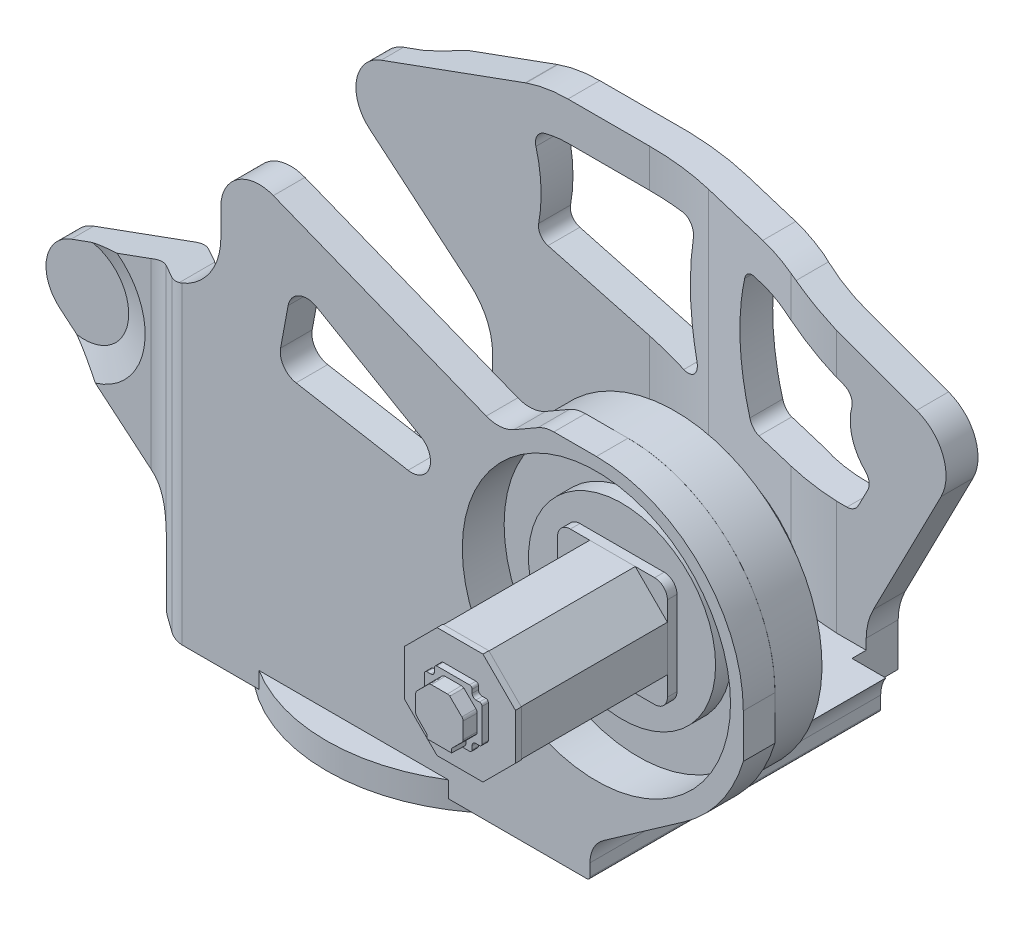
from build123d import *

# Parameters (mm, degrees)
SKETCH5_R           = 279.99944
BASE_EXTRUDE_DEPTH  = 40.64
BOSS_EXTRUDE1_DEPTH = 592.328
CUT_EXTRUDE1_DEPTH  = 645.16
CUT_EXTRUDE2_DEPTH  = 746.76
CUT_EXTRUDE3_DEPTH  = 137.16
SKETCH12_R          = 230.124
BOSS_EXTRUDE2_DEPTH = 73.66
SKETCH13_R          = 165.1
BOSS_EXTRUDE3_DEPTH = 46.99
SKETCH14_R          = 110.000000487
CUT_EXTRUDE4_DEPTH  = 14.732
CUT_EXTRUDE4_DRAFT  = -70
SKETCH15_R          = 110.000000487
CUT_EXTRUDE5_DEPTH  = 14.732
CUT_EXTRUDE5_DRAFT  = -70
SKETCH16_R          = 210.000005689
CUT_EXTRUDE6_DEPTH  = 65.532
SKETCH17_R          = 146.499150033
BOSS_EXTRUDE4_DEPTH = 25.4
CUT_EXTRUDE7_DEPTH  = 58.42
BOSS_EXTRUDE5_DEPTH = 14.9225
BOSS_EXTRUDE6_DEPTH = 229.5525
BOSS_EXTRUDE7_DEPTH = 9.2075
EXTRUDE1_DEPTH      = 10
EXTRUDE2_DEPTH      = 21.7475
EXTRUDE2_DRAFT      = 1


with BuildPart() as part:
    # Sketch5 → Base-Extrude (new body)
    with BuildSketch(Plane(origin=(0, 0, 0), x_dir=(1, 0, 0), z_dir=(0, 1, 0))):
        Circle(SKETCH5_R)
    extrude(amount=BASE_EXTRUDE_DEPTH)

    # Sketch7 → Boss-Extrude1 (add)
    with BuildSketch(Plane.XY.offset(237.470768924)):
        with BuildLine():
            Line((-320, 15), (365, 15))
            ThreePointArc((365, 15), (368.535533906, 16.464466094), (370, 20))
            Line((370, 20), (369.999997924, 38.97338))
            ThreePointArc((369.999997924, 38.97338), (375.648824796, 62.059602178), (391.31894, 79.92942))
            Line((391.31894, 79.92942), (517.66908, 168.41103))
            ThreePointArc((517.66908, 168.41103), (574.661777559, 224.619114997), (609.999998169, 296.443390546))
            Line((609.999998169, 296.443390546), (610, 364.99994))
            ThreePointArc((610, 364.99994), (542.634561472, 527.634501472), (380, 594.99994))
            Line((380, 594.99994), (313.35019, 594.99999871))
            ThreePointArc((313.35019, 594.99999871), (300.451848092, 593.307693227), (288.426629357, 588.345311118))
            Line((288.426629357, 588.345311118), (250.91462175, 566.775906957))
            ThreePointArc((250.91462175, 566.775906957), (229.60166481, 560.251756882), (207.5712, 563.6378))
            Line((207.5712, 563.6378), (-125.849603884, 695.761602153))
            ThreePointArc((-125.849603884, 695.761602153), (-181.697001766, 689.643841861), (-208.000001718, 640))
            Line((-208.000001718, 640), (-208.000001718, 597.50735))
            ThreePointArc((-208.000001718, 597.50735), (-226.084799306, 540.149706929), (-273.797989413, 503.538088386))
            Line((-273.797989413, 503.538088386), (-499.52121, 421.38155))
            ThreePointArc((-499.52121, 421.38155), (-538.088468005, 375.418886181), (-517.56726, 319.03733))
            Line((-517.56726, 319.03733), (-360.7212412, 187.42789857))
            ThreePointArc((-360.7212412, 187.42789857), (-334.36922012, 153.085279149), (-324.999998133, 110.82345))
            Line((-324.999998133, 110.82345), (-325, 20))
            ThreePointArc((-325, 20), (-323.535533906, 16.464466094), (-320, 15))
        make_face()
    extrude(amount=-BOSS_EXTRUDE1_DEPTH)

    # Sketch8 → Cut-Extrude1 (cut)
    with BuildSketch(Plane(origin=(0, 711.2, 0), x_dir=(-1, 0, 0), z_dir=(0, 1, 0))):
        with BuildLine():
            Line((534, -305), (79.16003, -304.999997297))
            ThreePointArc((79.16003, -304.999997297), (26.284839531, -301.882770521), (-25.857800631, -292.574282628))
            Line((-25.857800631, -292.574282628), (-195.634158682, -251.827967502))
            ThreePointArc((-195.634158682, -251.827967502), (-236.923956566, -243.954175272), (-278.7714, -240))
            Line((-278.7714, -240), (-640.135262635, -240))
            Line((-640.135262635, -240), (-640.135262635, 188.000000434))
            Line((-640.135262635, 188.000000434), (-220.258534809, 188.000000434))
            Line((-220.258534809, 188.000000434), (223.415876424, 188.000000434))
            Line((223.415876424, 188.000000434), (255.593035136, 188.000000434))
            ThreePointArc((255.593035136, 188.000000434), (267.271379261, 185.557900055), (276.9926, 178.64086))
            Line((276.9926, 178.64086), (310.335159488, 154.745348815))
            ThreePointArc((310.335159488, 154.745348815), (325.303913294, 147.313418989), (341.855205208, 145))
            Line((341.855205208, 145), (534, 145))
            Line((534, 145), (553.895380573, 145))
            Line((553.895380573, 145), (553.895380573, -305))
            Line((553.895380573, -305), (534, -305))
        make_face()
    extrude(amount=-CUT_EXTRUDE1_DEPTH, mode=Mode.SUBTRACT)

    # Sketch10 → Cut-Extrude2 (cut)
    with BuildSketch(Plane(origin=(86.326185056, 711.2, -208.856690882), x_dir=(-1, 0, 0), z_dir=(0, 1, 0))):
        with BuildLine():
            Line((286.47264948, 446.327459805), (347.395663879, 446.327459805))
            ThreePointArc((347.395663879, 446.327459805), (364.176871053, 444.761225907), (379.385455111, 437.497550957))
            Line((379.385455111, 437.497550957), (413.266914043, 413.215839468))
            ThreePointArc((413.266914043, 413.215839468), (428.754656216, 405.720497442), (445.859525056, 403.856691751))
            Line((445.859525056, 403.856691751), (643.355007055, 403.856691751))
            Line((643.355007055, 403.856691751), (643.355007055, 469.302072156))
            Line((643.355007055, 469.302072156), (286.47264948, 481.952752742))
            Line((286.47264948, 481.952752742), (286.47264948, 446.327459805))
        make_face()
        with BuildLine():
            Line((-18.673800559, -116.143310059), (48.799735046, -132.33695916))
            ThreePointArc((48.799735046, -132.33695916), (106.736002471, -142.679725184), (165.486215056, -146.143309076))
            Line((165.486215056, -146.143309076), (212.176007222, -146.143309076))
            Line((212.176007222, -146.143309076), (212.176007222, -224.529226835))
            Line((212.176007222, -224.529226835), (-585.623772318, -224.529226835))
            Line((-585.623772318, -224.529226835), (-585.623772318, -81.181309118))
            Line((-585.623772318, -81.181309118), (-192.445214944, -81.181309118))
            ThreePointArc((-192.445214944, -81.181309118), (-150.355133683, -84.504343601), (-109.307973119, -94.391107899))
            Line((-109.307973119, -94.391107899), (-18.673800559, -116.143310059))
        make_face()
    extrude(amount=-CUT_EXTRUDE2_DEPTH, mode=Mode.SUBTRACT)

    # Sketch11 → Cut-Extrude3 (cut)
    with BuildSketch(Plane(origin=(0, 0, -354.857231076), x_dir=(-1, 0, 0), z_dir=(0, 0, -1))):
        with BuildLine():
            Line((465.640101755, 433.71327166), (310.335159488, 490.23964524))
            Line((310.335159488, 490.23964524), (278.997937915, 501.645460701))
            ThreePointArc((278.997937915, 501.645460701), (243.633971151, 511.633100774), (207.041252078, 515))
            Line((207.041252078, 515), (-137.279297922, 515))
            ThreePointArc((-137.279297922, 515), (-172.008934474, 511.96154954), (-205.683327922, 502.93852))
            Line((-205.683327922, 502.93852), (-403.941407922, 430.77848))
            ThreePointArc((-403.941407922, 430.77848), (-445.177514908, 390.532163879), (-442.250107922, 332.98555))
            Line((-442.250107922, 332.98555), (-336.071287922, 126.52742))
            ThreePointArc((-336.071287922, 126.52742), (-327.98766041, 105.065992744), (-324.999997922, 82.3281))
            Line((-324.999997922, 82.3281), (-324.999997922, 0))
            Line((-324.999997922, 0), (-658.849729434, 0))
            Line((-658.849729434, 0), (-658.849729434, 772.256984031))
            Line((-658.849729434, 772.256984031), (465.640101755, 772.256984031))
            Line((465.640101755, 772.256984031), (465.640101755, 433.71327166))
        make_face()
        with BuildLine():
            Line((207.041252078, 455), (23.980192078, 455))
            ThreePointArc((23.980192078, 455), (8.678349063, 447.878416045), (4.273842037, 431.585359993))
            ThreePointArc((4.273842037, 431.585359993), (9.666549337, 348.875899056), (-2.540927922, 266.89472))
            ThreePointArc((-2.540927922, 266.89472), (2.727055648, 247.668493792), (21.992332078, 242.54516))
            Line((21.992332078, 242.54516), (238.292522078, 300.50262))
            ThreePointArc((238.292522078, 300.50262), (250.022445344, 309.135778276), (252.786848889, 323.435449414))
            ThreePointArc((252.786848889, 323.435449414), (249.209377594, 374.811928433), (257.153336322, 425.696448839))
            ThreePointArc((257.153336322, 425.696448839), (255.198888324, 440.946540953), (242.999171617, 450.303468266))
            ThreePointArc((242.999171617, 450.303468266), (225.172919044, 453.820901809), (207.041252078, 455))
        make_face()
        with BuildLine():
            Line((-289.865850049, 408.447884842), (-185.162117922, 446.55696))
            ThreePointArc((-185.162117922, 446.55696), (-161.590043363, 452.873083655), (-137.279297922, 455))
            Line((-137.279297922, 455), (-119.231907922, 455))
            ThreePointArc((-119.231907922, 455), (-107.06029257, 450.869839246), (-99.915749477, 440.185179583))
            ThreePointArc((-99.915749477, 440.185179583), (-90.495984505, 348.046581053), (-110.605797504, 257.637241202))
            ThreePointArc((-110.605797504, 257.637241202), (-117.985938375, 248.457119625), (-129.246019975, 245.000000332))
            Line((-129.246019975, 245.000000332), (-294.796103946, 245.000000332))
            ThreePointArc((-294.796103946, 245.000000332), (-305.248263176, 247.937173069), (-312.640540304, 255.88883045))
            Line((-312.640540304, 255.88883045), (-327.478797922, 284.7409))
            ThreePointArc((-327.478797922, 284.7409), (-329.439433733, 297.062961303), (-323.714945364, 308.149327725))
            ThreePointArc((-323.714945364, 308.149327725), (-302.92070013, 343.580677856), (-302.453468907, 384.66063528))
            ThreePointArc((-302.453468907, 384.66063528), (-300.738692696, 398.97737017), (-289.865850049, 408.447884842))
        make_face()
    extrude(amount=-CUT_EXTRUDE3_DEPTH, mode=Mode.SUBTRACT)

    # Sketch12 → Boss-Extrude2 (add)
    with BuildSketch(Plane(origin=(0, 0, 188.000000434), x_dir=(-1, 0, 0), z_dir=(0, 0, -1))):
        with Locations((-379.999997922, 365)):
            Circle(SKETCH12_R)
    extrude(amount=BOSS_EXTRUDE2_DEPTH)

    # Sketch13 → Boss-Extrude3 (add)
    with BuildSketch(Plane(origin=(0, 0, 114.340000434), x_dir=(-1, 0, 0), z_dir=(0, 0, -1))):
        with Locations((-379.999997922, 365)):
            Circle(SKETCH13_R)
    extrude(amount=BOSS_EXTRUDE3_DEPTH)


with BuildPart() as cut_extrude4_tool:
    # Sketch14 → Cut-Extrude4 (with draft: the straight prism first)
    with BuildSketch(Plane.XY.offset(195.00000087)):
        with Locations((-479.000002078, 365)):
            Circle(SKETCH14_R)
    extrude(amount=-CUT_EXTRUDE4_DEPTH)
    # Cut-Extrude4: the draft: its side faces are tilted about the plane it starts from
    cut_extrude4_sides = [cut_extrude4_tool.faces().sort_by_distance(p)[0] for p in [
        (-589.000002565, 365, 187.63400087),
    ]]
    draft(cut_extrude4_sides, Plane.XY.offset(195.00000087), CUT_EXTRUDE4_DRAFT)


with BuildPart() as part_1:
    add(part.part)

    # Cut-Extrude4: cut by cut_extrude4_tool
    add(cut_extrude4_tool.part, mode=Mode.SUBTRACT)


with BuildPart() as cut_extrude5_tool:
    # Sketch15 → Cut-Extrude5 (with draft: the straight prism first)
    with BuildSketch(Plane(origin=(0, 0, -354.857231076), x_dir=(-1, 0, 0), z_dir=(0, 0, -1))):
        with Locations((479.000002078, 365)):
            Circle(SKETCH15_R)
    extrude(amount=-CUT_EXTRUDE5_DEPTH)
    # Cut-Extrude5: the draft: its side faces are tilted about the plane it starts from
    cut_extrude5_sides = [cut_extrude5_tool.faces().sort_by_distance(p)[0] for p in [
        (-369.000001591, 365, -347.491231076),
    ]]
    draft(cut_extrude5_sides, Plane(origin=(0, 0, -354.857231076), x_dir=(-1, 0, 0), z_dir=(0, 0, -1)), CUT_EXTRUDE5_DRAFT)


with BuildPart() as part_2:
    add(part_1.part)

    # Cut-Extrude5: cut by cut_extrude5_tool
    add(cut_extrude5_tool.part, mode=Mode.SUBTRACT)

    # Sketch16 → Cut-Extrude6 (cut)
    with BuildSketch(Plane.XY.offset(237.470768924)):
        with Locations((380, 364.99994)):
            Circle(SKETCH16_R)
    extrude(amount=-CUT_EXTRUDE6_DEPTH, mode=Mode.SUBTRACT)

    # Sketch17 → Boss-Extrude4 (add)
    with BuildSketch(Plane.XY.offset(171.938768924)):
        with Locations((380, 364.99994)):
            Circle(SKETCH17_R)
    extrude(amount=BOSS_EXTRUDE4_DEPTH)

    # Sketch18 → Cut-Extrude7 (cut)
    with BuildSketch(Plane.XY.offset(237.470768924)):
        with BuildLine():
            Line((-58.23227, 578.77214), (105.28689, 484.3643))
            ThreePointArc((105.28689, 484.3643), (118.477666982, 448.122939024), (85.07745, 428.83931))
            Line((85.07745, 428.83931), (-90.201249311, 459.74567391))
            ThreePointArc((-90.201249311, 459.74567391), (-109.639940489, 472.188168162), (-114.49027, 494.75258))
            Line((-114.49027, 494.75258), (-102.73073, 558.25405))
            ThreePointArc((-102.73073, 558.25405), (-85.794088304, 580.034732644), (-58.23227, 578.77214))
        make_face()
    extrude(amount=-CUT_EXTRUDE7_DEPTH, mode=Mode.SUBTRACT)

    # Sketch19 → Boss-Extrude5 (add)
    with BuildSketch(Plane.XY.offset(197.338768924)):
        with BuildLine():
            Line((446, 451), (314, 451))
            ThreePointArc((314, 451), (299.857864376, 445.142135624), (294, 431))
            Line((294, 431), (294, 299))
            ThreePointArc((294, 299), (299.857864376, 284.857864376), (314, 279))
            Line((314, 279), (446, 279))
            ThreePointArc((446, 279), (460.142135624, 284.857864376), (466, 299))
            Line((466, 299), (466, 431))
            ThreePointArc((466, 431), (460.142135624, 445.142135624), (446, 451))
        make_face()
    extrude(amount=BOSS_EXTRUDE5_DEPTH)

    # Sketch20 → Boss-Extrude6 (add)
    with BuildSketch(Plane.XY.offset(212.261268924)):
        Polygon((466.00006, 329.37758), (466.000037926, 400.622353291), (415.62236, 451), (344.377586709, 450.999977926), (293.99994, 400.6223), (293.999962074, 329.377526709), (344.37764, 278.99988), (415.622413291, 278.999902074), align=None)
    extrude(amount=BOSS_EXTRUDE6_DEPTH)

    # Sketch21 → Boss-Extrude7 (add)
    with BuildSketch(Plane.XY.offset(441.813768924)):
        Polygon((415.938044261, 278.237902171), (466.762060098, 329.061949502), (466.762037829, 400.937984261), (415.937990498, 451.762000098), (344.061955739, 451.761977829), (293.237939902, 400.937930498), (293.237962171, 329.061895739), (344.062009502, 278.237879902), align=None)
    extrude(amount=BOSS_EXTRUDE7_DEPTH)

    # Sketch24 → Extrude1 (add)
    with BuildSketch(Plane.XY.offset(451.021268924)):
        with BuildLine():
            Line((353.924943154, 409.500323154), (404.924999739, 409.500323154))
            ThreePointArc((404.924999739, 409.500323154), (407.753426873, 408.328750275), (408.924999752, 405.50032314))
            Line((408.924999752, 405.50032314), (408.924999752, 400.000323154))
            ThreePointArc((408.924999752, 400.000323154), (410.682359065, 395.757682467), (414.924999752, 394.000323154))
            Line((414.924999752, 394.000323154), (420.424999752, 394.000323154))
            ThreePointArc((420.424999752, 394.000323154), (423.253426877, 392.828750279), (424.424999753, 390.000323154))
            Line((424.424999753, 390.000323154), (424.424999753, 339.000323154))
            ThreePointArc((424.424999753, 339.000323154), (423.253426877, 336.171896029), (420.424999753, 335.000323154))
            Line((420.424999753, 335.000323154), (414.924999753, 335.000323154))
            ThreePointArc((414.924999753, 335.000323154), (410.682359065, 333.242963841), (408.924999752, 329.000323154))
            Line((408.924999752, 329.000323154), (408.924999752, 323.500323154))
            ThreePointArc((408.924999752, 323.500323154), (407.753426877, 320.671896029), (404.924999752, 319.500323154))
            Line((404.924999752, 319.500323154), (353.924999752, 319.500323154))
            ThreePointArc((353.924999752, 319.500323154), (351.096572628, 320.671896029), (349.924999753, 323.500323154))
            Line((349.924999753, 323.500323154), (349.924999753, 329.000323154))
            ThreePointArc((349.924999753, 329.000323154), (348.176864553, 333.233719629), (343.951117847, 335.000266307))
            Line((343.951117847, 335.000266307), (338.740137922, 335.02295))
            ThreePointArc((338.740137922, 335.02295), (335.81082675, 336.174397197), (334.425, 339.00038))
            Line((334.425, 339.00038), (334.425, 390.00038))
            ThreePointArc((334.425, 390.00038), (335.593045768, 392.825275613), (338.415017613, 394.000367544))
            Line((338.415017613, 394.000367544), (344.345825512, 394.015168495))
            ThreePointArc((344.345825512, 394.015168495), (348.432534684, 395.79864913), (349.925, 400.00038))
            Line((349.925, 400.00038), (349.925, 405.50038))
            ThreePointArc((349.925, 405.50038), (351.096556225, 408.328766929), (353.924943154, 409.500323154))
        make_face()
    extrude(amount=EXTRUDE1_DEPTH)


with BuildPart() as extrude2_tool:
    # Sketch25 → Extrude2 (with draft: the straight prism first)
    with BuildSketch(Plane.XY.offset(461.021268924)):
        with BuildLine():
            ThreePointArc((366.791469416, 402.000380001), (364.112673821, 401.467534817), (361.841699999, 399.950120001))
            Line((361.841699999, 399.950120001), (343.975294239, 382.083734241))
            ThreePointArc((343.975294239, 382.083734241), (342.457854141, 379.81272671), (341.925, 377.13389))
            Line((341.925, 377.13389), (341.925, 351.86686))
            ThreePointArc((341.925, 351.86686), (342.474273051, 349.194900775), (343.975200002, 346.917119998))
            Line((343.975200002, 346.917119998), (359.925000002, 330.553149998))
            Line((359.925000002, 330.553149998), (359.925000002, 324.500379999))
            Line((359.925000002, 324.500379999), (398.925000001, 324.500379999))
            Line((398.925000001, 324.500379999), (399.217800001, 331.260259999))
            Line((399.217800001, 331.260259999), (414.874893908, 346.917258968))
            ThreePointArc((414.874893908, 346.917258968), (416.392264621, 349.188153543), (416.925094575, 351.866860001))
            Line((416.925094575, 351.866860001), (416.925094575, 377.170050147))
            ThreePointArc((416.925094575, 377.170050147), (416.39194848, 379.832157565), (414.874747467, 382.083637469))
            Line((414.874747467, 382.083637469), (396.034412645, 400.727891474))
            ThreePointArc((396.034412645, 400.727891474), (394.145789402, 401.674503722), (392.058499975, 402.000380001))
            Line((392.058499975, 402.000380001), (366.791469416, 402.000380001))
        make_face()
    extrude(amount=EXTRUDE2_DEPTH)
    # Extrude2: the draft: its side faces are tilted about the plane it starts from
    extrude2_sides = [extrude2_tool.faces().sort_by_distance(p)[0] for p in [
        (364.112673821, 401.467534817, 471.895018924),
        (352.908497119, 391.016927121, 471.895018924),
        (342.457854141, 379.81272671, 471.895018924),
        (341.925, 364.500375, 471.895018924),
        (342.474273051, 349.194900775, 471.895018924),
        (351.950100002, 338.735134998, 471.895018924),
        (359.925000002, 327.526764998, 471.895018924),
        (379.425000002, 324.500379999, 471.895018924),
        (399.071400001, 327.880319999, 471.895018924),
        (407.046346955, 339.088759484, 471.895018924),
        (416.392264621, 349.188153543, 471.895018924),
        (416.925094575, 364.518455074, 471.895018924),
        (416.39194848, 379.832157565, 471.895018924),
        (405.454580056, 391.405764472, 471.895018924),
        (394.145789402, 401.674503722, 471.895018924),
        (379.424984695, 402.000380001, 471.895018924),
    ]]
    draft(extrude2_sides, Plane.XY.offset(461.021268924), EXTRUDE2_DRAFT)


with BuildPart() as part_3:
    add(part_2.part)

    # Extrude2: add extrude2_tool
    add(extrude2_tool.part)


solid = part_3.part
